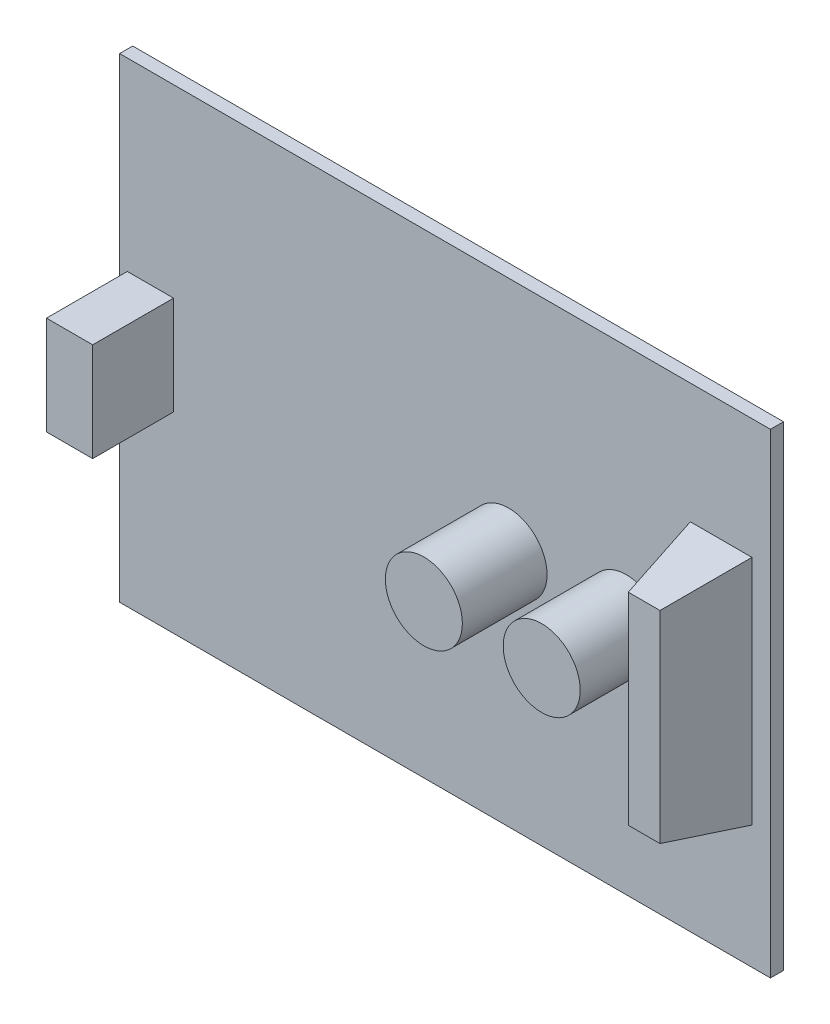
from build123d import *

# Parameters (mm, degrees)
SKETCH1_W           = 84.5
SKETCH1_H           = 61.7
BOSS_EXTRUDE1_DEPTH = 1.7
SKETCH2_W           = 8
SKETCH2_H           = 30.1
BOSS_EXTRUDE2_DEPTH = 10
BOSS_EXTRUDE2_TAPER = 11
SKETCH3_R           = 5
BOSS_EXTRUDE3_DEPTH = 11
SKETCH4_R           = 5
BOSS_EXTRUDE4_DEPTH = 11
SKETCH5_W           = 6
SKETCH5_H           = 12.8
BOSS_EXTRUDE5_DEPTH = 10.5


with BuildPart() as part:
    # Sketch1 → Boss-Extrude1 (new body)
    with BuildSketch(Plane.XY):
        with Locations((11.152950311, 11.889984472)):
            Rectangle(SKETCH1_W, SKETCH1_H)
    extrude(amount=BOSS_EXTRUDE1_DEPTH)

    # Sketch2 → Boss-Extrude2 (add)
    with BuildSketch(Plane.XY.offset(1.7)):
        with Locations((47.002950311, 12.089984472)):
            Rectangle(SKETCH2_W, SKETCH2_H)
    extrude(amount=BOSS_EXTRUDE2_DEPTH, taper=BOSS_EXTRUDE2_TAPER)

    # Sketch3 → Boss-Extrude3 (add)
    with BuildSketch(Plane.XY.offset(1.7)):
        with Locations((19.402950311, 11.889984472)):
            Circle(SKETCH3_R)
    extrude(amount=BOSS_EXTRUDE3_DEPTH)

    # Sketch4 → Boss-Extrude4 (add)
    with BuildSketch(Plane.XY.offset(1.7)):
        with Locations((34.702950311, 12.039984472)):
            Circle(SKETCH4_R)
    extrude(amount=BOSS_EXTRUDE4_DEPTH)

    # Sketch5 → Boss-Extrude5 (add)
    with BuildSketch(Plane.XY.offset(1.7)):
        with Locations((-27.097049689, 12.339984472)):
            Rectangle(SKETCH5_W, SKETCH5_H)
    extrude(amount=BOSS_EXTRUDE5_DEPTH)


solid = part.part
